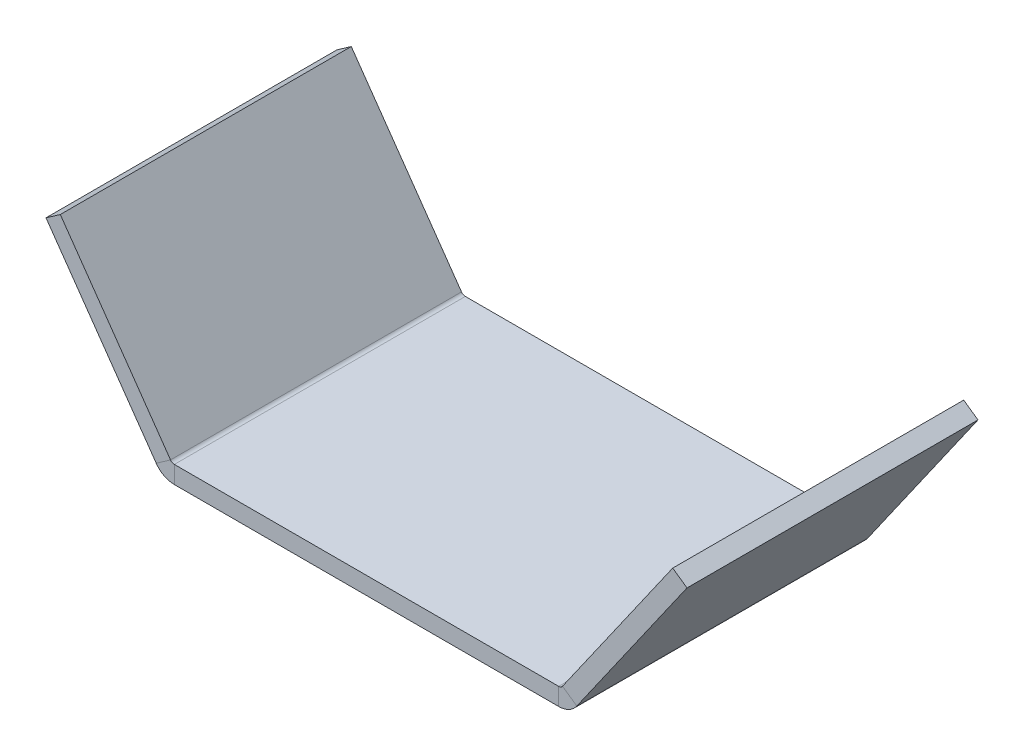
from build123d import *

# Parameters (mm, degrees)
BASE_FLANGE1_DEPTH      = 20
BASE_FLANGE1_DEPTH_BACK = 30


# Sheet-metal steps are written as plain solids
with BuildPart() as part:
    # Sketch2 → Base-Flange1 (new, two sides: drawn at the far end of the back side and taken through both)
    with BuildSketch(Plane.XY.offset(-BASE_FLANGE1_DEPTH_BACK)):
        with BuildLine():
            Line((-20.075175272, 28.67032155), (-1.134622976, 1.620409542))
            ThreePointArc((-1.134622976, 1.620409542), (0.223510062, 0.429358834), (1.978154792, 0))
            Line((1.978154792, 0), (68.021845208, 0))
            ThreePointArc((68.021845208, 0), (69.776489938, 0.429358834), (71.134622976, 1.620409542))
            Line((71.134622976, 1.620409542), (90.075175272, 28.67032155))
            Line((90.075175272, 28.67032155), (87.617719139, 30.391050859))
            Line((87.617719139, 30.391050859), (68.677166843, 3.341138851))
            ThreePointArc((68.677166843, 3.341138851), (68.391244098, 3.090391333), (68.021845208, 3))
            Line((68.021845208, 3), (1.978154792, 3))
            ThreePointArc((1.978154792, 3), (1.608755902, 3.090391333), (1.322833157, 3.341138851))
            Line((1.322833157, 3.341138851), (-17.617719139, 30.391050859))
            Line((-17.617719139, 30.391050859), (-20.075175272, 28.67032155))
        make_face()
    extrude(amount=BASE_FLANGE1_DEPTH + BASE_FLANGE1_DEPTH_BACK)


solid = part.part
